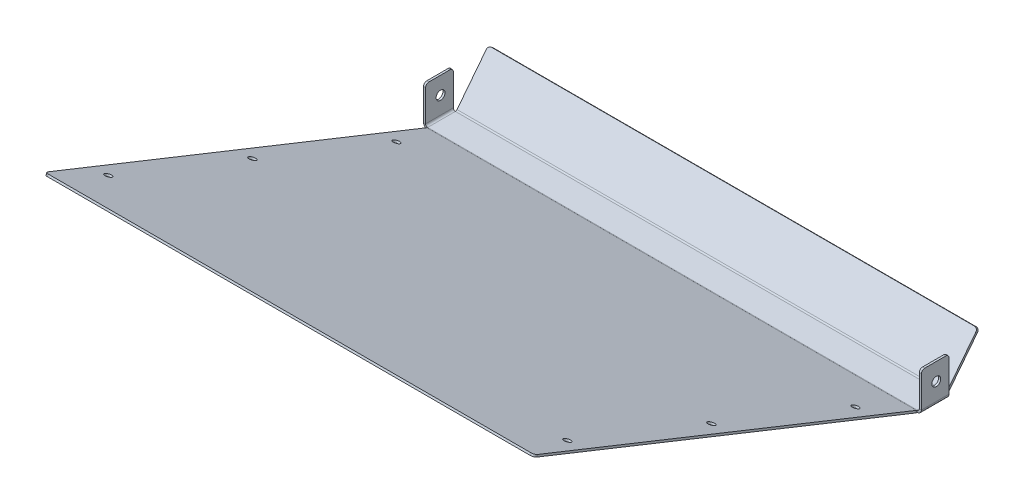
from build123d import *

# Parameters (mm, degrees)
SKETCH1_W                        = 480.822
SKETCH1_H                        = 76.2
BASE_FLANGE1_DEPTH               = 2.032
EDGE_FLANGE3_START               = -240.411
EDGE_FLANGE3_DEPTH               = 480.822
EDGE_FLANGE3_2_DEPTH             = 480.822
EDGE_FLANGE1_DEPTH               = 70.328201504
EDGE_FLANGE1_BEND_DEPTH          = 70.328201504
EDGE_FLANGE2_DEPTH               = 480.822
F_11_32_0_34375_DIAMETER_HOLE1_D = 8.73125
F_17_64_0_26563_DIAMETER_HOLE1_D = 6.747002
FILLET1_R                        = 3.175
SKETCH25_W                       = 47.165600752
SKETCH25_H                       = 38.1
CUT_EXTRUDE1_DEPTH               = 655.776434505
EDGE_FLANGE4_DEPTH               = 480.822
FILLET2_R                        = 3.175


# Read off the part's stored shape, not the designer's step: Edge-Flange3
# Sheet-metal steps are written as plain solids
with BuildPart() as part:
    # Sketch1 → Base-Flange1 (new body)
    with BuildSketch(Plane(origin=(0, 0, 0), x_dir=(1, 0, 0), z_dir=(0, 1, 0))):
        Rectangle(SKETCH1_W, SKETCH1_H)
    extrude(amount=-BASE_FLANGE1_DEPTH)

    # Edge-Flange3 outline → Edge-Flange3 (cut)
    with BuildSketch(Plane.YZ.offset(EDGE_FLANGE3_START)):
        with BuildLine():
            ThreePointArc((-2.032, 32.228201504), (-1.958948217, 32.995292327), (-1.742419128, 33.734805713))
            Line((-1.742419128, 33.734805713), (0, 38.1))
            Line((0, 38.1), (-2.032, 38.1))
            Line((-2.032, 38.1), (-2.032, 32.228201504))
        make_face()
    extrude(amount=EDGE_FLANGE3_DEPTH, mode=Mode.SUBTRACT)

    # Edge-Flange3 2 outline → Edge-Flange3 2 (add)
    with BuildSketch(Plane.YZ.offset(EDGE_FLANGE3_START)):
        with BuildLine():
            Line((148.005784856, 408.891387665), (0, 38.1))
            Line((0, 38.1), (0, 32.228201504))
            ThreePointArc((0, 32.228201504), (0.036525892, 32.611746915), (0.144790436, 32.981503608))
            Line((0.144790436, 32.981503608), (149.89299442, 408.13808556))
            Line((149.89299442, 408.13808556), (148.005784856, 408.891387665))
        make_face()
    extrude(amount=EDGE_FLANGE3_2_DEPTH)

    # Edge-Flange1 section (across the edge) → Edge-Flange1 (add)
    with BuildSketch(Plane(origin=(-242.443, 0, -38.1), x_dir=(1, 0, 0), z_dir=(0, 0, 1))):
        with BuildLine():
            Line((-2.032, 2.032), (-2.032, 36.068))
            Line((-2.032, 36.068), (0, 36.068))
            Line((0, 36.068), (0, 2.032))
            ThreePointArc((0, 2.032), (0.595159021, 0.595159021), (2.032, 0))
            Line((2.032, 0), (2.032, -2.032))
            ThreePointArc((2.032, -2.032), (-0.841681959, -0.841681959), (-2.032, 2.032))
        make_face()
    extrude(amount=EDGE_FLANGE1_DEPTH)

    # Edge-Flange1 section 2 (across the edge) → Edge-Flange1 bend (add)
    with BuildSketch(Plane(origin=(242.443, 0, 32.228201504), x_dir=(-1, 0, 0), z_dir=(0, 0, -1))):
        with BuildLine():
            Line((-2.032, 2.032), (-2.032, 36.068))
            Line((-2.032, 36.068), (0, 36.068))
            Line((0, 36.068), (0, 2.032))
            ThreePointArc((0, 2.032), (0.595159021, 0.595159021), (2.032, 0))
            Line((2.032, 0), (2.032, -2.032))
            ThreePointArc((2.032, -2.032), (-0.841681959, -0.841681959), (-2.032, 2.032))
        make_face()
    extrude(amount=EDGE_FLANGE1_BEND_DEPTH)

    # Edge-Flange2 section (across the edge) → Edge-Flange2 (add)
    with BuildSketch(Plane(origin=(240.411, 0, -40.132), x_dir=(0, 0, 1), z_dir=(-1, 0, 0))):
        with BuildLine():
            Line((-2.032, 2.032), (-2.032, 36.068))
            Line((-2.032, 36.068), (0, 36.068))
            Line((0, 36.068), (0, 2.032))
            ThreePointArc((0, 2.032), (0.595159021, 0.595159021), (2.032, 0))
            Line((2.032, 0), (2.032, -2.032))
            ThreePointArc((2.032, -2.032), (-0.841681959, -0.841681959), (-2.032, 2.032))
        make_face()
    extrude(amount=EDGE_FLANGE2_DEPTH)

    # 11/32 (0.34375) Diameter Hole1 (through all)
    with Locations(Plane(origin=(244.475, 0, 0), x_dir=(0, 0, -1), z_dir=(1, 0, 0))):
        with Locations((-17.557349869, 19.03458979)):
            Hole(F_11_32_0_34375_DIAMETER_HOLE1_D / 2)

    # 17/64 (0.26563) Diameter Hole1 (through all)
    with Locations(Plane(origin=(0, -13.117977393, 5.236196428), x_dir=(-1, 0, 0), z_dir=(0, -0.9287448642521535, 0.370719539713311))):
        with Locations((225.425, -79.024412767), (225.425, -231.424412767), (225.425, -383.824412767), (-225.425, -383.824412767), (-225.425, -231.424412767), (-225.425, -79.024412767)):
            Hole(F_17_64_0_26563_DIAMETER_HOLE1_D / 2)

    # Fillet1
    fillet1_edges = [part.edges().sort_by_distance(p)[0] for p in [
        (-240.411, 148.949389638, 408.514736612),
        (240.411, 148.949389638, 408.514736612),
        (-243.459, 36.068, -38.1),
        (-243.459, 36.068, 32.228201504),
        (243.459, 36.068, 32.228201504),
        (243.459, 36.068, -38.1),
        (240.411, 36.068, -41.148),
        (-240.411, 36.068, -41.148),
    ]]
    fillet(fillet1_edges, radius=FILLET1_R)

    # Sketch25 → Cut-Extrude1 (cut, through all)
    with BuildSketch(Plane(origin=(244.475, 0, 0), x_dir=(0, 0, -1), z_dir=(1, 0, 0))):
        with Locations((18.581199624, 17.018)):
            Rectangle(SKETCH25_W, SKETCH25_H)
    extrude(amount=-CUT_EXTRUDE1_DEPTH, mode=Mode.SUBTRACT)

    # Edge-Flange4 section (across the edge) → Edge-Flange4 (add)
    with BuildSketch(Plane(origin=(240.411, 0, 4.010528132), x_dir=(0, 0.6156614753256621, 0.788010753606719), z_dir=(-1, 0, 0))):
        with BuildLine():
            Line((-2.032, 0.99107262), (-2.032, 50.8))
            Line((-2.032, 50.8), (0, 50.8))
            Line((0, 50.8), (0, 0.99107262))
            ThreePointArc((0, 0.99107262), (0.205650498, 0.10030245), (0.780975882, -0.610165231))
            Line((0.780975882, -0.610165231), (-0.470048236, -2.211403083))
            ThreePointArc((-0.470048236, -2.211403083), (-1.620699004, -0.790467721), (-2.032, 0.99107262))
        make_face()
    extrude(amount=EDGE_FLANGE4_DEPTH)

    # Fillet2
    fillet2_edges = [part.edges().sort_by_distance(p)[0] for p in [
        (-243.459, 36.068, 5.001600752),
        (243.459, 36.068, 5.001600752),
        (240.411, 39.405434224, -28.06569374),
        (-240.411, 39.405434224, -28.06569374),
    ]]
    fillet(fillet2_edges, radius=FILLET2_R)


solid = part.part
